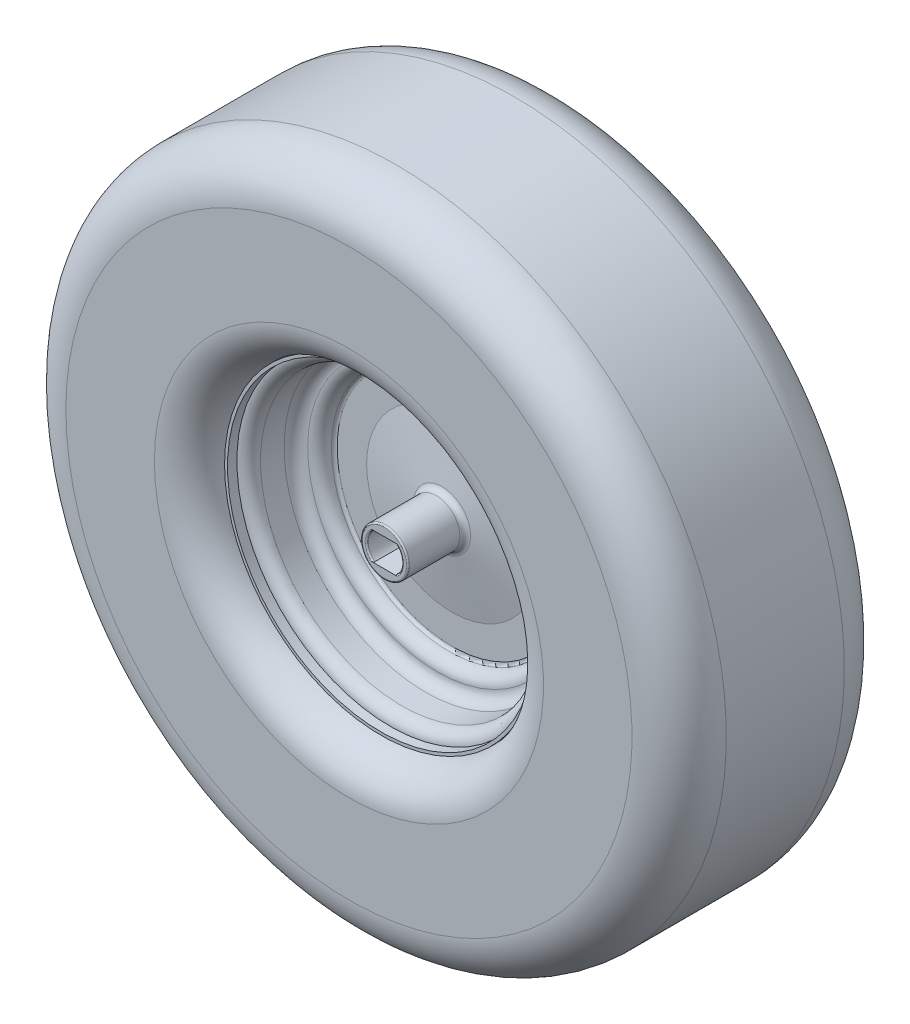
from build123d import *

# Parameters (mm, degrees)
SKETCH2_R      = 12.7
EXTRUDE1_DEPTH = 76.2
SKETCH3_R      = 9.525
EXTRUDE2_DEPTH = 143.332810123
FILLET1_R      = 3.175
FILLET2_R      = 0.79375
EXTRUDE3_DEPTH = 30.48


# Read off the part's stored shape, not the designer's step: Revolve-Thin1
with BuildPart() as part:
    # Revolve-Thin1 outline → Revolve-Thin1 (revolve)
    with BuildSketch(Plane.XZ):
        with BuildLine():
            Line((0, 38.1), (0, 36.5125))
            Line((0, 36.5125), (11.1125, 36.5125))
            Line((11.1125, 36.5125), (11.1125, 6.133730055))
            Line((11.1125, 6.133730055), (45.898611747, 0))
            Line((45.898611747, 0), (61.9125, 0))
            ThreePointArc((61.9125, 0), (64.15756403, 0.92993597), (65.0875, 3.175))
            ThreePointArc((65.0875, 3.175), (66.482403955, 6.542596045), (69.85, 7.9375))
            ThreePointArc((69.85, 7.9375), (75.462660076, 10.262339924), (77.7875, 15.875))
            Line((77.7875, 15.875), (77.7875, 28.575))
            ThreePointArc((77.7875, 28.575), (79.800369343, 32.463564967), (84.1375, 33.065128061))
            Line((84.1375, 33.065128061), (84.1375, 40.005))
            Line((84.1375, 40.005), (82.55, 40.005))
            Line((82.55, 40.005), (82.55, 34.925))
            ThreePointArc((82.55, 34.925), (78.059871939, 33.065128061), (76.2, 28.575))
            Line((76.2, 28.575), (76.2, 15.875))
            ThreePointArc((76.2, 15.875), (74.340128061, 11.384871939), (69.85, 9.525))
            ThreePointArc((69.85, 9.525), (65.359871939, 7.665128061), (63.5, 3.175))
            ThreePointArc((63.5, 3.175), (63.035032015, 2.052467985), (61.9125, 1.5875))
            Line((61.9125, 1.5875), (46.0375, 1.5875))
            Line((46.0375, 1.5875), (12.7, 7.465800719))
            Line((12.7, 7.465800719), (12.7, 38.1))
            Line((12.7, 38.1), (0, 38.1))
        make_face()
    revolve_thin1 = revolve(axis=Axis((0, 0, 0), (0, 0, 1)))

    # Mirror1: Revolve-Thin1 across plane
    add(revolve_thin1.mirror(Plane.XY))

    # Sketch2 → Extrude1 (add)
    with BuildSketch(Plane.XY.offset(38.1)):
        Circle(SKETCH2_R)
    extrude(amount=-EXTRUDE1_DEPTH)

    # Sketch3 → Extrude2 (cut, through all)
    with BuildSketch(Plane.XY.offset(38.1)):
        Circle(SKETCH3_R)
    extrude(amount=-EXTRUDE2_DEPTH, mode=Mode.SUBTRACT)

    # Fillet1
    fillet1_edges = [part.edges().sort_by_distance(p)[0] for p in [
        (-12.7, 0, 7.465800719),
    ]]
    fillet(fillet1_edges, radius=FILLET1_R)

    # Fillet2
    fillet2_edges = [part.edges().sort_by_distance(p)[0] for p in [
        (-12.7, 0, 38.1),
        (-12.7, 0, -38.1),
        (-9.525, 0, -38.1),
        (-9.525, 0, 38.1),
    ]]
    fillet(fillet2_edges, radius=FILLET2_R)

    # Sketch4 → Extrude3 (add)
    with BuildSketch(Plane.XY.offset(38.1)):
        with BuildLine():
            Line((-7.094473382, 7.493), (7.094473382, 7.493))
            ThreePointArc((7.094473382, 7.493), (0, 10.31875), (-7.094473382, 7.493))
        make_face()
        with BuildLine():
            Line((-7.094473382, -7.493), (7.094473382, -7.493))
            ThreePointArc((7.094473382, -7.493), (0, -10.31875), (-7.094473382, -7.493))
        make_face()
    extrude(amount=-EXTRUDE3_DEPTH)

    # Sketch5 → Revolve-Thin2 (revolve)
    with BuildSketch(Plane(origin=(0, 0, 0), x_dir=(0, 0, -1), z_dir=(1, 0, 0)), mode=Mode.PRIVATE) as revolve_thin2_sk:
        with BuildLine():
            Line((-33.065128061, 84.1375), (-36.53506403, 84.1375))
            ThreePointArc((-36.53506403, 84.1375), (-51.112025048, 90.175474952), (-57.15, 104.75243597))
            Line((-57.15, 104.75243597), (-57.15, 152.4))
            ThreePointArc((-57.15, 152.4), (-49.710512242, 170.360512242), (-31.75, 177.8))
            Line((-31.75, 177.8), (0, 177.8))
            Line((0, 177.8), (0, 176.2125))
            Line((0, 176.2125), (-31.75, 176.2125))
            ThreePointArc((-31.75, 176.2125), (-48.587980227, 169.237980227), (-55.5625, 152.4))
            Line((-55.5625, 152.4), (-55.5625, 104.75243597))
            ThreePointArc((-55.5625, 104.75243597), (-49.989493033, 91.298006967), (-36.53506403, 85.725))
            Line((-36.53506403, 85.725), (-33.065128061, 85.725))
            Line((-33.065128061, 85.725), (-33.065128061, 84.1375))
        make_face()
    revolve_thin2 = revolve(revolve_thin2_sk.sketch.rotate(Axis((0, 0, -33.649525455), (0, 0, 1)), 90), axis=Axis((0, 0, -33.649525455), (0, 0, 1)))

    # Mirror2: Revolve-Thin2 across Front Plane
    add(revolve_thin2.mirror(Plane.XY))


solid = part.part
